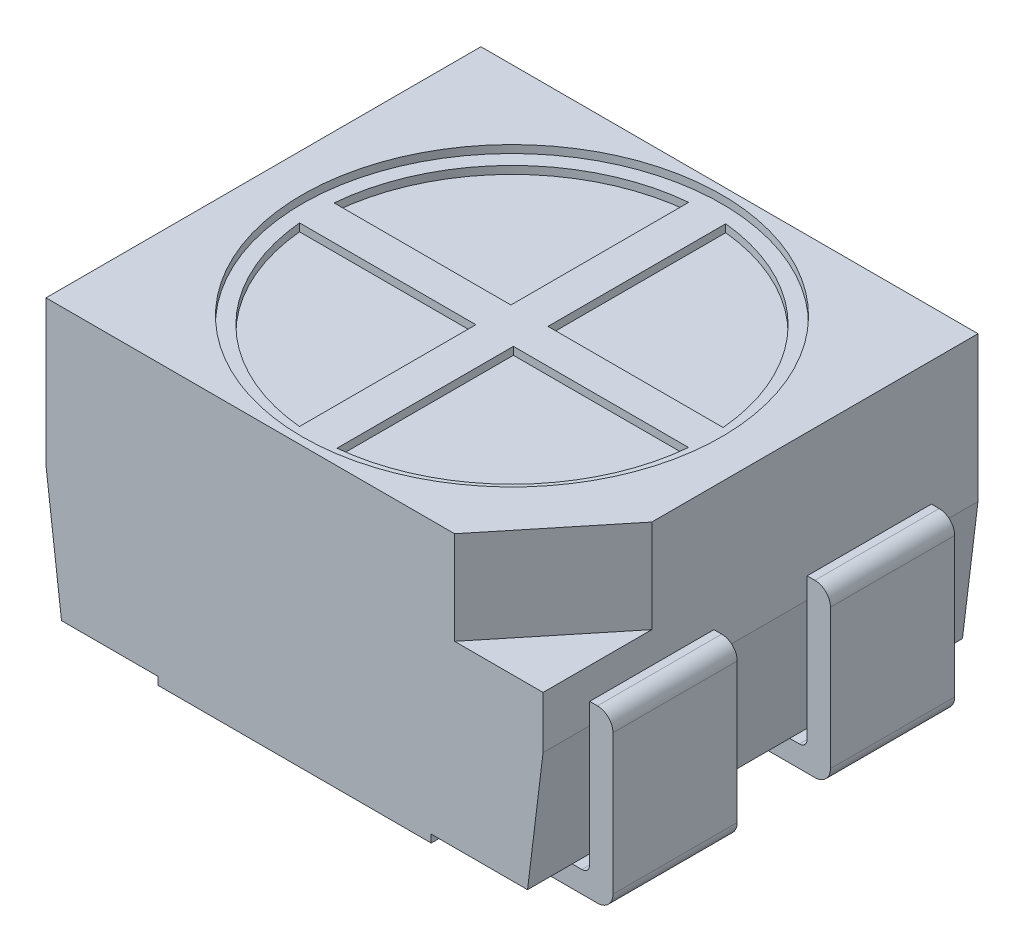
from build123d import *

# Parameters (mm, degrees)
SKETCH1_W              = 3.2
SKETCH1_H              = 2.8
BOSS_EXTRUDE1_DEPTH    = 1.75
CHAMFER1_SIZE          = 0.1
CHAMFER1_SIZE2         = 0.814434643
SKETCH3_W              = 0.8
SKETCH3_H              = 1.1
BOSS_EXTRUDE2_DEPTH    = 0.8
FILLET1_R              = 0.1
FILLET2_R              = 0.1
FILLET3_R              = 0.1
CUT_EXTRUDE3_DEPTH     = 1
FILLET5_R              = 0.05
FILLET6_R              = 0.05
LPATTERN1_COUNT        = 2
LPATTERN1_PITCH        = 1.4
FILLET1_OF_LPATTERN1_R = 0.1
FILLET2_OF_LPATTERN1_R = 0.1
FILLET3_OF_LPATTERN1_R = 0.1
FILLET5_OF_LPATTERN1_R = 0.05
FILLET6_OF_LPATTERN1_R = 0.05
CHAMFER2_SIZE          = 0.1
CHAMFER2_SIZE2         = 0.814434643
MIRROR2_START          = -2.5
MIRROR2_DEPTH          = 0.8
MIRROR2_START_2        = -1.1
MIRROR2_2_DEPTH        = 0.8
SKETCH7_W              = 1.76
SKETCH7_H              = 2.8
BOSS_EXTRUDE4_DEPTH    = 0.05
CUT_EXTRUDE4_DEPTH     = 0.6
SKETCH9_R              = 1.35
CUT_EXTRUDE5_DEPTH     = 0.05
CUT_EXTRUDE6_DEPTH     = 0.05


# Read off the part's stored shape, not the designer's step: Mirror2
with BuildPart() as part:
    # Sketch1 → Boss-Extrude1 (new body)
    with BuildSketch(Plane(origin=(0, 0, 0), x_dir=(1, 0, 0), z_dir=(0, 1, 0))):
        with Locations((1.6, 1.4)):
            Rectangle(SKETCH1_W, SKETCH1_H)
    extrude(amount=BOSS_EXTRUDE1_DEPTH)

    # Chamfer1
    chamfer1_edges = [part.edges().sort_by_distance(p)[0] for p in [
        (0, 0, -1.4),
    ]]
    chamfer1_side = [part.faces().sort_by_distance(p)[0] for p in [
        (1.6, 0, -1.4),
    ]]
    chamfer(chamfer1_edges, length=CHAMFER1_SIZE, length2=CHAMFER1_SIZE2, reference=chamfer1_side[0])

    # Sketch3 → Boss-Extrude2 (add)
    with BuildSketch(Plane(origin=(0, 0, -2.5), x_dir=(-1, 0, 0), z_dir=(0, 0, -1))):
        with Locations((-0.25, 0.4)):
            Rectangle(SKETCH3_W, SKETCH3_H)
    boss_extrude2 = extrude(amount=-BOSS_EXTRUDE2_DEPTH)

    # Fillet1
    fillet1_edges = [part.edges().sort_by_distance(p)[0] for p in [
        (-0.15, 0.95, -2.1),
    ]]
    fillet(fillet1_edges, radius=FILLET1_R)

    # Fillet2
    fillet2_edges = [part.edges().sort_by_distance(p)[0] for p in [
        (-0.15, -0.15, -2.1),
    ]]
    fillet(fillet2_edges, radius=FILLET2_R)

    # Fillet3
    fillet3_edges = [part.edges().sort_by_distance(p)[0] for p in [
        (0.65, -0.15, -2.1),
    ]]
    fillet(fillet3_edges, radius=FILLET3_R)

    # Sketch6 → Cut-Extrude3 (cut)
    with BuildSketch(Plane.XY.offset(-1.7)):
        Polygon((0, 0.814434643), (0, -0.012278456), (0.514539268, -0.012278456), (0.514539268, 0), (0.1, 0), align=None)
    cut_extrude3 = extrude(amount=-CUT_EXTRUDE3_DEPTH, mode=Mode.SUBTRACT)

    # Fillet5
    fillet5_edges = [part.edges().sort_by_distance(p)[0] for p in [
        (0, -0.012278456, -2.1),
    ]]
    fillet(fillet5_edges, radius=FILLET5_R)

    # Fillet6
    # the kernel refuses this fillet: 0.05 mm, written as the material it adds along each edge
    with BuildSketch(Plane(origin=(0.514539268, -0.012278456, -1.7), x_dir=(-1, 0, 0), z_dir=(0, 0, -1))) as fillet6_piece_1:
        with BuildLine():
            CenterArc((0.032818975, 0.05), FILLET6_R, 228.975665985, 41.024334015)
            Line((0, 0.012278456), (-0.00065638, 0.011524025))
            ThreePointArc((-0.00065638, 0.011524025), (-0.001, 0.006139228), (-0.001, 0))
            Line((-0.001, 0), (0, -0.001))
            Line((0, -0.001), (0.032818975, -0.001))
            Line((0.032818975, -0.001), (0.032818975, 0))
        make_face()
    extrude(amount=0.8)

    # LPattern1: Boss-Extrude2, Cut-Extrude3 ×2
    with Locations(*[(0, 0, i * LPATTERN1_PITCH) for i in range(1, LPATTERN1_COUNT)]):
        add(boss_extrude2)
        add(cut_extrude3, mode=Mode.SUBTRACT)

    # Fillet1 of LPattern1
    fillet1_of_lpattern1_edges = [part.edges().sort_by_distance(p)[0] for p in [
        (-0.15, 0.95, -0.7),
    ]]
    fillet(fillet1_of_lpattern1_edges, radius=FILLET1_OF_LPATTERN1_R)

    # Fillet2 of LPattern1
    fillet2_of_lpattern1_edges = [part.edges().sort_by_distance(p)[0] for p in [
        (-0.15, -0.15, -0.7),
    ]]
    fillet(fillet2_of_lpattern1_edges, radius=FILLET2_OF_LPATTERN1_R)

    # Fillet3 of LPattern1
    fillet3_of_lpattern1_edges = [part.edges().sort_by_distance(p)[0] for p in [
        (0.65, -0.15, -0.7),
    ]]
    fillet(fillet3_of_lpattern1_edges, radius=FILLET3_OF_LPATTERN1_R)

    # Fillet5 of LPattern1
    fillet5_of_lpattern1_edges = [part.edges().sort_by_distance(p)[0] for p in [
        (0, -0.012278456, -0.7),
    ]]
    fillet(fillet5_of_lpattern1_edges, radius=FILLET5_OF_LPATTERN1_R)

    # Fillet6 of LPattern1
    # the kernel refuses this fillet: 0.05 mm, written as the material it adds along each edge
    with BuildSketch(Plane(origin=(0.514539268, -0.012278456, -0.3), x_dir=(-1, 0, 0), z_dir=(0, 0, -1))) as fillet6_of_lpattern1_piece_1:
        with BuildLine():
            CenterArc((0.032818975, 0.05), FILLET6_OF_LPATTERN1_R, 228.975665985, 41.024334015)
            Line((0, 0.012278456), (-0.00065638, 0.011524025))
            ThreePointArc((-0.00065638, 0.011524025), (-0.001, 0.006139228), (-0.001, 0))
            Line((-0.001, 0), (0, -0.001))
            Line((0, -0.001), (0.032818975, -0.001))
            Line((0.032818975, -0.001), (0.032818975, 0))
        make_face()
    extrude(amount=0.8)

    # Chamfer2
    chamfer2_edges = [part.edges().sort_by_distance(p)[0] for p in [
        (3.2, 0, -1.4),
    ]]
    chamfer2_side = [part.faces().sort_by_distance(p)[0] for p in [
        (1.677343693, 0, -1.4),
    ]]
    chamfer(chamfer2_edges, length=CHAMFER2_SIZE, length2=CHAMFER2_SIZE2, reference=chamfer2_side[0])

    # Mirror2 outline → Mirror2 (add)
    with BuildSketch(Plane.XY.offset(MIRROR2_START)):
        with BuildLine():
            Line((3.25, 0.95), (3.2, 0.95))
            Line((3.2, 0.95), (3.2, 0.037721544))
            ThreePointArc((3.2, 0.037721544), (3.185355339, 0.002366205), (3.15, -0.012278456))
            Line((3.15, -0.012278456), (2.718279707, -0.012278456))
            ThreePointArc((2.718279707, -0.012278456), (2.700759393, -0.009108346), (2.685460732, 0))
            Line((2.685460732, 0), (2.55, 0))
            Line((2.55, 0), (2.55, -0.05))
            ThreePointArc((2.55, -0.05), (2.579289322, -0.120710678), (2.65, -0.15))
            Line((2.65, -0.15), (3.25, -0.15))
            ThreePointArc((3.25, -0.15), (3.320710678, -0.120710678), (3.35, -0.05))
            Line((3.35, -0.05), (3.35, 0.85))
            ThreePointArc((3.35, 0.85), (3.320710678, 0.920710678), (3.25, 0.95))
        make_face()
    extrude(amount=MIRROR2_DEPTH)

    # Mirror2 2 outline → Mirror2 2 (add)
    with BuildSketch(Plane.XY.offset(MIRROR2_START_2)):
        with BuildLine():
            Line((3.25, 0.95), (3.2, 0.95))
            Line((3.2, 0.95), (3.2, 0.037721544))
            ThreePointArc((3.2, 0.037721544), (3.185355339, 0.002366205), (3.15, -0.012278456))
            Line((3.15, -0.012278456), (2.718279707, -0.012278456))
            ThreePointArc((2.718279707, -0.012278456), (2.700759393, -0.009108346), (2.685460732, 0))
            Line((2.685460732, 0), (2.55, 0))
            Line((2.55, 0), (2.55, -0.05))
            ThreePointArc((2.55, -0.05), (2.579289322, -0.120710678), (2.65, -0.15))
            Line((2.65, -0.15), (3.25, -0.15))
            ThreePointArc((3.25, -0.15), (3.320710678, -0.120710678), (3.35, -0.05))
            Line((3.35, -0.05), (3.35, 0.85))
            ThreePointArc((3.35, 0.85), (3.320710678, 0.920710678), (3.25, 0.95))
        make_face()
    extrude(amount=MIRROR2_2_DEPTH)

    # Sketch7 → Boss-Extrude4 (add)
    with BuildSketch(Plane.XZ):
        with Locations((1.6, -1.4)):
            Rectangle(SKETCH7_W, SKETCH7_H)
    extrude(amount=BOSS_EXTRUDE4_DEPTH)

    # Sketch8 → Cut-Extrude4 (cut)
    with BuildSketch(Plane(origin=(0, 1.75, 0), x_dir=(1, 0, 0), z_dir=(0, 1, 0))):
        Polygon((3.2, 0.7), (2.630450534, 0), (3.2, 0), align=None)
    extrude(amount=-CUT_EXTRUDE4_DEPTH, mode=Mode.SUBTRACT)

    # Sketch9 → Cut-Extrude5 (cut)
    with BuildSketch(Plane(origin=(0, 1.75, 0), x_dir=(1, 0, 0), z_dir=(0, 1, 0))):
        with Locations(Location((1.6, 1.4, 0), (0, 0, 270))):
            Circle(SKETCH9_R)
    extrude(amount=-CUT_EXTRUDE5_DEPTH, mode=Mode.SUBTRACT)

    # Sketch10 → Cut-Extrude6 (cut)
    with BuildSketch(Plane(origin=(0, 1.7, 0), x_dir=(1, 0, 0), z_dir=(0, 1, 0))):
        with BuildLine():
            Line((1.725002215, 1.506501375), (1.725002215, 2.650765477))
            ThreePointArc((1.725002215, 2.650765477), (2.495375318, 2.282237423), (2.852476462, 1.506501375))
            Line((2.852476462, 1.506501375), (1.725002215, 1.506501375))
        make_face()
        with BuildLine():
            Line((0.348304372, 1.283963542), (1.483343314, 1.283963542))
            Line((1.483343314, 1.283963542), (1.483343314, 0.148362024))
            ThreePointArc((1.483343314, 0.148362024), (0.710902302, 0.511342761), (0.348304372, 1.283963542))
        make_face()
        with BuildLine():
            Line((1.725002215, 0.148386564), (1.725002215, 1.283963542))
            Line((1.725002215, 1.283963542), (2.852476462, 1.283963542))
            ThreePointArc((2.852476462, 1.283963542), (2.492606098, 0.513762954), (1.725002215, 0.148386564))
        make_face()
        with BuildLine():
            Line((1.486402288, 2.65107156), (1.486402288, 1.506501375))
            Line((1.486402288, 1.506501375), (0.348304372, 1.506501375))
            ThreePointArc((0.348304372, 1.506501375), (0.709204455, 2.285758311), (1.486402288, 2.65107156))
        make_face()
    extrude(amount=-CUT_EXTRUDE6_DEPTH, mode=Mode.SUBTRACT)


solid = part.part
